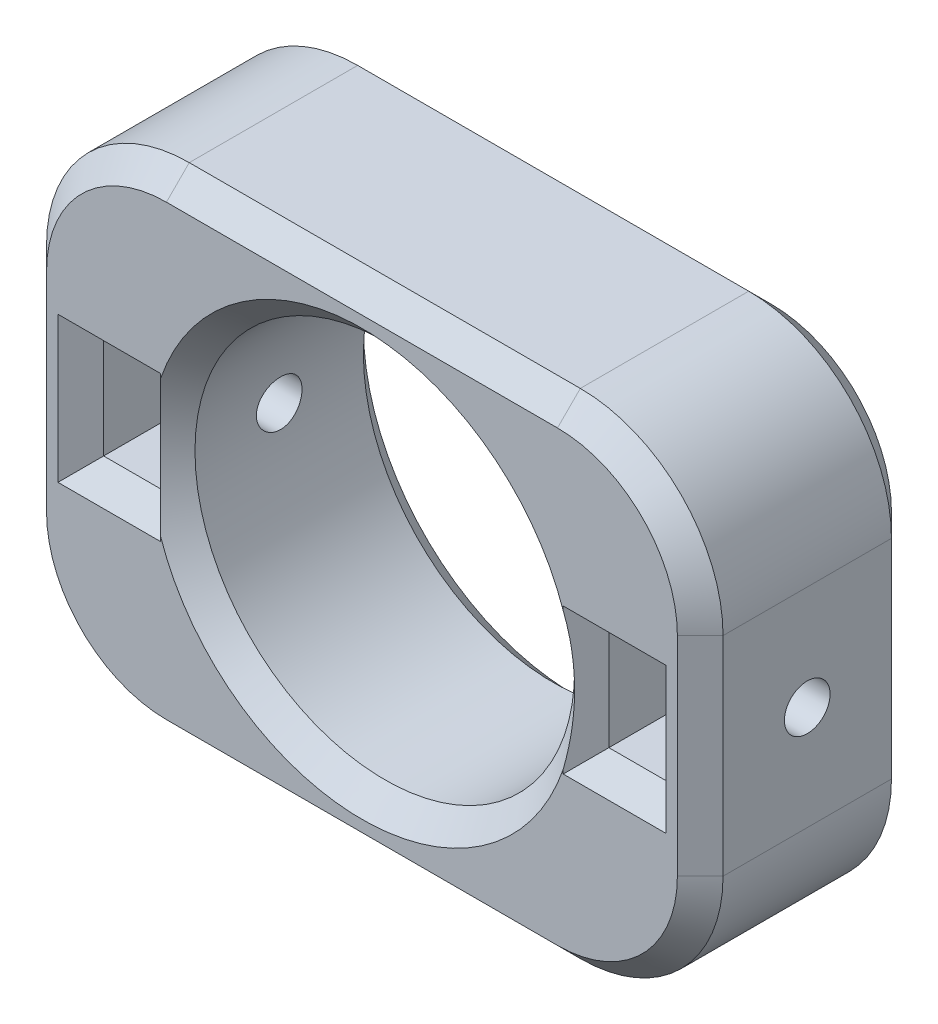
from build123d import *

# Parameters (mm, degrees)
SKETCH1_W           = 47.4
SKETCH1_H           = 34.6
SKETCH1_R           = 13.3
BOSS_EXTRUDE1_DEPTH = 15
SKETCH2_R           = 1.6
CUT_EXTRUDE1_DEPTH  = 53.640763672
SKETCH3_W           = 4
SKETCH3_H           = 7
CUT_EXTRUDE2_DEPTH  = 13
CHAMFER1_SIZE       = 1.6
FILLET1_R           = 10
CHAMFER3_SIZE       = 1.6
CHAMFER4_SIZE       = 1.6


with BuildPart() as part:
    # Sketch1 → Boss-Extrude1 (new body)
    with BuildSketch(Plane.XY):
        Rectangle(SKETCH1_W, SKETCH1_H)
        Circle(SKETCH1_R, mode=Mode.SUBTRACT)
    extrude(amount=BOSS_EXTRUDE1_DEPTH)

    # Sketch2 → Cut-Extrude1 (cut, through all)
    with BuildSketch(Plane(origin=(23.7, 0, 0), x_dir=(0, 0, -1), z_dir=(1, 0, 0))):
        with Locations((-7.5, 0)):
            Circle(SKETCH2_R)
    extrude(amount=-CUT_EXTRUDE1_DEPTH, mode=Mode.SUBTRACT)

    # Sketch3 → Cut-Extrude2 (cut)
    with BuildSketch(Plane.XY.offset(15)):
        with Locations((17.7, 0)):
            Rectangle(SKETCH3_W, SKETCH3_H)
        with Locations((-17.7, 0)):
            Rectangle(SKETCH3_W, SKETCH3_H)
    extrude(amount=-CUT_EXTRUDE2_DEPTH, mode=Mode.SUBTRACT)

    # Chamfer1
    chamfer1_edges = [part.edges().sort_by_distance(p)[0] for p in [
        (-13.3, 0, 15),
    ]]
    chamfer(chamfer1_edges, length=CHAMFER1_SIZE)

    # Chamfer2
    # the kernel refuses this chamfer: 1.6 mm, written as the material it takes off along each edge
    with BuildSketch(Plane(origin=(19.7, -3.5, 15), x_dir=(0.9996219169112968, 0, 0.027495876610586226), z_dir=(0, 1, 0)), Plane(origin=(15.7, 3.5, 15), x_dir=(-0.9996219169112968, 0, 0.027495876610586285), z_dir=(0, -1, 0)), Plane(origin=(-15.7, -3.5, 15), x_dir=(0.9996219169112968, 0, 0.027495876610586285), z_dir=(0, 1, 0)), Plane(origin=(-19.7, 3.5, 15), x_dir=(-0.9996219169112968, 0, 0.027495876610586226), z_dir=(0, -1, 0))) as chamfer2_piece_1:
        with BuildLine():
            Line((1.645877112, 0), (-0.090475448, 1.64338847))
            Line((-0.090475448, 1.64338847), (-0.122463349, 1.642508602))
            ThreePointArc((-0.122463349, 1.642508602), (-0.054606763, 0.821436527), (-0.031987901, -0.000879868))
            Line((-0.031987901, -0.000879868), (0.000879868, -0.031987901))
            ThreePointArc((0.000879868, -0.031987901), (0.823196264, -0.009369039), (1.64675698, -0.031987901))
            Line((1.64675698, -0.031987901), (1.645877112, 0))
        make_face()
    extrude(amount=7, mode=Mode.SUBTRACT)
    with BuildSketch(Plane(origin=(19.7, 3.5, 15), x_dir=(0, 0.9996219169112968, 0.027495876610586285), z_dir=(-1, 0, 0)), Plane(origin=(15.7, -3.5, 15), x_dir=(0, -0.9996219169112968, 0.02749587661058628), z_dir=(1, 0, 0)), Plane(origin=(-15.7, 3.5, 15), x_dir=(2.330586862957201e-15, 0.9996219169112966, 0.027495876610586265), z_dir=(-1, 0, 0)), Plane(origin=(-19.7, -3.5, 15), x_dir=(2.3305868629572013e-15, -0.9996219169112968, 0.02749587661058628), z_dir=(1, 0, 0))) as chamfer2_piece_2:
        with BuildLine():
            Line((1.645877112, 0), (-0.090475448, 1.64338847))
            Line((-0.090475448, 1.64338847), (-0.122463349, 1.642508602))
            ThreePointArc((-0.122463349, 1.642508602), (-0.054606763, 0.821436527), (-0.031987901, -0.000879868))
            Line((-0.031987901, -0.000879868), (0.000879868, -0.031987901))
            ThreePointArc((0.000879868, -0.031987901), (0.823196264, -0.009369039), (1.64675698, -0.031987901))
            Line((1.64675698, -0.031987901), (1.645877112, 0))
        make_face()
    extrude(amount=4, mode=Mode.SUBTRACT)
    with BuildSketch(Plane(origin=(15.7, -3.5, 15), x_dir=(0, -0.9996219169112968, 0.02749587661058628), z_dir=(1, 0, 0))) as chamfer2_piece_3a_section:
        with BuildLine():
            Line((1.645877112, 0), (-0.090475448, 1.64338847))
            Line((-0.090475448, 1.64338847), (-0.122463349, 1.642508602))
            ThreePointArc((-0.122463349, 1.642508602), (-0.054606763, 0.821436527), (-0.031987901, -0.000879868))
            Line((-0.031987901, -0.000879868), (0.000879868, -0.031987901))
            ThreePointArc((0.000879868, -0.031987901), (0.823196264, -0.009369039), (1.64675698, -0.031987901))
            Line((1.64675698, -0.031987901), (1.645877112, 0))
        make_face()
    chamfer2_piece_3a = extrude(amount=8.114692781, mode=Mode.PRIVATE)
    chamfer2_piece_3a = split(chamfer2_piece_3a, bisect_by=Plane(origin=(19.7, -4.027669803, 14.472330197), z_dir=(1, 0, 0)), keep=Keep.TOP, mode=Mode.PRIVATE)
    with BuildSketch(Plane(origin=(19.7, -7.614692781, 15), x_dir=(0.9996219169112968, 0, 0.027495876610586226), z_dir=(0, 1, 0))) as chamfer2_piece_3b_section:
        with BuildLine():
            Line((1.645877112, 0), (-0.090475448, 1.64338847))
            Line((-0.090475448, 1.64338847), (-0.122463349, 1.642508602))
            ThreePointArc((-0.122463349, 1.642508602), (-0.054606763, 0.821436527), (-0.031987901, -0.000879868))
            Line((-0.031987901, -0.000879868), (0.000879868, -0.031987901))
            ThreePointArc((0.000879868, -0.031987901), (0.823196264, -0.009369039), (1.64675698, -0.031987901))
            Line((1.64675698, -0.031987901), (1.645877112, 0))
        make_face()
    chamfer2_piece_3b = extrude(amount=11.114692781, mode=Mode.PRIVATE)
    chamfer2_piece_3b = split(chamfer2_piece_3b, bisect_by=Plane(origin=(20.227669803, -3.5, 14.472330197), z_dir=(0, -1, 0)), keep=Keep.TOP, mode=Mode.PRIVATE)
    chamfer2_piece_3 = chamfer2_piece_3a & chamfer2_piece_3b
    add(chamfer2_piece_3, mode=Mode.SUBTRACT)
    with BuildSketch(Plane(origin=(19.7, -3.5, 15), x_dir=(0.9996219169112968, 0, 0.027495876610586226), z_dir=(0, 1, 0))) as chamfer2_piece_4a_section:
        with BuildLine():
            Line((1.645877112, 0), (-0.090475448, 1.64338847))
            Line((-0.090475448, 1.64338847), (-0.122463349, 1.642508602))
            ThreePointArc((-0.122463349, 1.642508602), (-0.054606763, 0.821436527), (-0.031987901, -0.000879868))
            Line((-0.031987901, -0.000879868), (0.000879868, -0.031987901))
            ThreePointArc((0.000879868, -0.031987901), (0.823196264, -0.009369039), (1.64675698, -0.031987901))
            Line((1.64675698, -0.031987901), (1.645877112, 0))
        make_face()
    chamfer2_piece_4a = extrude(amount=11.114692781, mode=Mode.PRIVATE)
    chamfer2_piece_4a = split(chamfer2_piece_4a, bisect_by=Plane(origin=(20.227669803, 3.5, 14.472330197), z_dir=(0, 1, 0)), keep=Keep.TOP, mode=Mode.PRIVATE)
    with BuildSketch(Plane(origin=(23.814692781, 3.5, 15), x_dir=(0, 0.9996219169112968, 0.02749587661058628), z_dir=(-1, 0, 0))) as chamfer2_piece_4b_section:
        with BuildLine():
            Line((1.645877112, 0), (-0.090475448, 1.64338847))
            Line((-0.090475448, 1.64338847), (-0.122463349, 1.642508602))
            ThreePointArc((-0.122463349, 1.642508602), (-0.054606763, 0.821436527), (-0.031987901, -0.000879868))
            Line((-0.031987901, -0.000879868), (0.000879868, -0.031987901))
            ThreePointArc((0.000879868, -0.031987901), (0.823196264, -0.009369039), (1.64675698, -0.031987901))
            Line((1.64675698, -0.031987901), (1.645877112, 0))
        make_face()
    chamfer2_piece_4b = extrude(amount=8.114692781, mode=Mode.PRIVATE)
    chamfer2_piece_4b = split(chamfer2_piece_4b, bisect_by=Plane(origin=(19.7, 4.027669803, 14.472330197), z_dir=(1, 0, 0)), keep=Keep.TOP, mode=Mode.PRIVATE)
    chamfer2_piece_4 = chamfer2_piece_4a & chamfer2_piece_4b
    add(chamfer2_piece_4, mode=Mode.SUBTRACT)
    with BuildSketch(Plane(origin=(19.7, 3.5, 15), x_dir=(0, 0.9996219169112968, 0.027495876610586285), z_dir=(-1, 0, 0))) as chamfer2_piece_5a_section:
        with BuildLine():
            Line((1.645877112, 0), (-0.090475448, 1.64338847))
            Line((-0.090475448, 1.64338847), (-0.122463349, 1.642508602))
            ThreePointArc((-0.122463349, 1.642508602), (-0.054606763, 0.821436527), (-0.031987901, -0.000879868))
            Line((-0.031987901, -0.000879868), (0.000879868, -0.031987901))
            ThreePointArc((0.000879868, -0.031987901), (0.823196264, -0.009369039), (1.64675698, -0.031987901))
            Line((1.64675698, -0.031987901), (1.645877112, 0))
        make_face()
    chamfer2_piece_5a = extrude(amount=8.114692781, mode=Mode.PRIVATE)
    chamfer2_piece_5a = split(chamfer2_piece_5a, bisect_by=Plane(origin=(15.7, 4.027669803, 14.472330197), z_dir=(-1, 0, 0)), keep=Keep.TOP, mode=Mode.PRIVATE)
    with BuildSketch(Plane(origin=(15.7, 7.614692781, 15), x_dir=(-0.9996219169112968, 0, 0.027495876610586285), z_dir=(0, -1, 0))) as chamfer2_piece_5b_section:
        with BuildLine():
            Line((1.645877112, 0), (-0.090475448, 1.64338847))
            Line((-0.090475448, 1.64338847), (-0.122463349, 1.642508602))
            ThreePointArc((-0.122463349, 1.642508602), (-0.054606763, 0.821436527), (-0.031987901, -0.000879868))
            Line((-0.031987901, -0.000879868), (0.000879868, -0.031987901))
            ThreePointArc((0.000879868, -0.031987901), (0.823196264, -0.009369039), (1.64675698, -0.031987901))
            Line((1.64675698, -0.031987901), (1.645877112, 0))
        make_face()
    chamfer2_piece_5b = extrude(amount=11.114692781, mode=Mode.PRIVATE)
    chamfer2_piece_5b = split(chamfer2_piece_5b, bisect_by=Plane(origin=(15.172330197, 3.5, 14.472330197), z_dir=(0, 1, 0)), keep=Keep.TOP, mode=Mode.PRIVATE)
    chamfer2_piece_5 = chamfer2_piece_5a & chamfer2_piece_5b
    add(chamfer2_piece_5, mode=Mode.SUBTRACT)
    with BuildSketch(Plane(origin=(11.585307219, -3.5, 15), x_dir=(0, -0.9996219169112966, 0.027495876610586265), z_dir=(1, 0, 0))) as chamfer2_piece_6a_section:
        with BuildLine():
            Line((1.645877112, 0), (-0.090475448, 1.64338847))
            Line((-0.090475448, 1.64338847), (-0.122463349, 1.642508602))
            ThreePointArc((-0.122463349, 1.642508602), (-0.054606763, 0.821436527), (-0.031987901, -0.000879868))
            Line((-0.031987901, -0.000879868), (0.000879868, -0.031987901))
            ThreePointArc((0.000879868, -0.031987901), (0.823196264, -0.009369039), (1.64675698, -0.031987901))
            Line((1.64675698, -0.031987901), (1.645877112, 0))
        make_face()
    chamfer2_piece_6a = extrude(amount=8.114692781, mode=Mode.PRIVATE)
    chamfer2_piece_6a = split(chamfer2_piece_6a, bisect_by=Plane(origin=(15.7, -4.027669803, 14.472330197), z_dir=(-1, 0, 0)), keep=Keep.TOP, mode=Mode.PRIVATE)
    with BuildSketch(Plane(origin=(15.7, 3.5, 15), x_dir=(-0.9996219169112968, 0, 0.027495876610586285), z_dir=(0, -1, 0))) as chamfer2_piece_6b_section:
        with BuildLine():
            Line((1.645877112, 0), (-0.090475448, 1.64338847))
            Line((-0.090475448, 1.64338847), (-0.122463349, 1.642508602))
            ThreePointArc((-0.122463349, 1.642508602), (-0.054606763, 0.821436527), (-0.031987901, -0.000879868))
            Line((-0.031987901, -0.000879868), (0.000879868, -0.031987901))
            ThreePointArc((0.000879868, -0.031987901), (0.823196264, -0.009369039), (1.64675698, -0.031987901))
            Line((1.64675698, -0.031987901), (1.645877112, 0))
        make_face()
    chamfer2_piece_6b = extrude(amount=11.114692781, mode=Mode.PRIVATE)
    chamfer2_piece_6b = split(chamfer2_piece_6b, bisect_by=Plane(origin=(15.172330197, -3.5, 14.472330197), z_dir=(0, -1, 0)), keep=Keep.TOP, mode=Mode.PRIVATE)
    chamfer2_piece_6 = chamfer2_piece_6a & chamfer2_piece_6b
    add(chamfer2_piece_6, mode=Mode.SUBTRACT)
    with BuildSketch(Plane(origin=(-19.7, -3.5, 15), x_dir=(2.3305868629572013e-15, -0.9996219169112968, 0.02749587661058628), z_dir=(1, 0, 0))) as chamfer2_piece_7a_section:
        with BuildLine():
            Line((1.645877112, 0), (-0.090475448, 1.64338847))
            Line((-0.090475448, 1.64338847), (-0.122463349, 1.642508602))
            ThreePointArc((-0.122463349, 1.642508602), (-0.054606763, 0.821436527), (-0.031987901, -0.000879868))
            Line((-0.031987901, -0.000879868), (0.000879868, -0.031987901))
            ThreePointArc((0.000879868, -0.031987901), (0.823196264, -0.009369039), (1.64675698, -0.031987901))
            Line((1.64675698, -0.031987901), (1.645877112, 0))
        make_face()
    chamfer2_piece_7a = extrude(amount=8.114692781, mode=Mode.PRIVATE)
    chamfer2_piece_7a = split(chamfer2_piece_7a, bisect_by=Plane(origin=(-15.7, -4.027669803, 14.472330197), z_dir=(1, 0, 0)), keep=Keep.TOP, mode=Mode.PRIVATE)
    with BuildSketch(Plane(origin=(-15.7, -7.614692781, 15), x_dir=(0.9996219169112968, 0, 0.027495876610586285), z_dir=(0, 1, 0))) as chamfer2_piece_7b_section:
        with BuildLine():
            Line((1.645877112, 0), (-0.090475448, 1.64338847))
            Line((-0.090475448, 1.64338847), (-0.122463349, 1.642508602))
            ThreePointArc((-0.122463349, 1.642508602), (-0.054606763, 0.821436527), (-0.031987901, -0.000879868))
            Line((-0.031987901, -0.000879868), (0.000879868, -0.031987901))
            ThreePointArc((0.000879868, -0.031987901), (0.823196264, -0.009369039), (1.64675698, -0.031987901))
            Line((1.64675698, -0.031987901), (1.645877112, 0))
        make_face()
    chamfer2_piece_7b = extrude(amount=11.114692781, mode=Mode.PRIVATE)
    chamfer2_piece_7b = split(chamfer2_piece_7b, bisect_by=Plane(origin=(-15.172330197, -3.5, 14.472330197), z_dir=(0, -1, 0)), keep=Keep.TOP, mode=Mode.PRIVATE)
    chamfer2_piece_7 = chamfer2_piece_7a & chamfer2_piece_7b
    add(chamfer2_piece_7, mode=Mode.SUBTRACT)
    with BuildSketch(Plane(origin=(-11.585307219, 3.5, 15), x_dir=(2.3305868629572017e-15, 0.9996219169112968, 0.027495876610586285), z_dir=(-1, 0, 0))) as chamfer2_piece_8a_section:
        with BuildLine():
            Line((1.645877112, 0), (-0.090475448, 1.64338847))
            Line((-0.090475448, 1.64338847), (-0.122463349, 1.642508602))
            ThreePointArc((-0.122463349, 1.642508602), (-0.054606763, 0.821436527), (-0.031987901, -0.000879868))
            Line((-0.031987901, -0.000879868), (0.000879868, -0.031987901))
            ThreePointArc((0.000879868, -0.031987901), (0.823196264, -0.009369039), (1.64675698, -0.031987901))
            Line((1.64675698, -0.031987901), (1.645877112, 0))
        make_face()
    chamfer2_piece_8a = extrude(amount=8.114692781, mode=Mode.PRIVATE)
    chamfer2_piece_8a = split(chamfer2_piece_8a, bisect_by=Plane(origin=(-15.7, 4.027669803, 14.472330197), z_dir=(1, 0, 0)), keep=Keep.TOP, mode=Mode.PRIVATE)
    with BuildSketch(Plane(origin=(-15.7, -3.5, 15), x_dir=(0.9996219169112968, 0, 0.027495876610586285), z_dir=(0, 1, 0))) as chamfer2_piece_8b_section:
        with BuildLine():
            Line((1.645877112, 0), (-0.090475448, 1.64338847))
            Line((-0.090475448, 1.64338847), (-0.122463349, 1.642508602))
            ThreePointArc((-0.122463349, 1.642508602), (-0.054606763, 0.821436527), (-0.031987901, -0.000879868))
            Line((-0.031987901, -0.000879868), (0.000879868, -0.031987901))
            ThreePointArc((0.000879868, -0.031987901), (0.823196264, -0.009369039), (1.64675698, -0.031987901))
            Line((1.64675698, -0.031987901), (1.645877112, 0))
        make_face()
    chamfer2_piece_8b = extrude(amount=11.114692781, mode=Mode.PRIVATE)
    chamfer2_piece_8b = split(chamfer2_piece_8b, bisect_by=Plane(origin=(-15.172330197, 3.5, 14.472330197), z_dir=(0, 1, 0)), keep=Keep.TOP, mode=Mode.PRIVATE)
    chamfer2_piece_8 = chamfer2_piece_8a & chamfer2_piece_8b
    add(chamfer2_piece_8, mode=Mode.SUBTRACT)
    with BuildSketch(Plane(origin=(-15.7, 3.5, 15), x_dir=(2.330586862957201e-15, 0.9996219169112966, 0.027495876610586265), z_dir=(-1, 0, 0))) as chamfer2_piece_9a_section:
        with BuildLine():
            Line((1.645877112, 0), (-0.090475448, 1.64338847))
            Line((-0.090475448, 1.64338847), (-0.122463349, 1.642508602))
            ThreePointArc((-0.122463349, 1.642508602), (-0.054606763, 0.821436527), (-0.031987901, -0.000879868))
            Line((-0.031987901, -0.000879868), (0.000879868, -0.031987901))
            ThreePointArc((0.000879868, -0.031987901), (0.823196264, -0.009369039), (1.64675698, -0.031987901))
            Line((1.64675698, -0.031987901), (1.645877112, 0))
        make_face()
    chamfer2_piece_9a = extrude(amount=8.114692781, mode=Mode.PRIVATE)
    chamfer2_piece_9a = split(chamfer2_piece_9a, bisect_by=Plane(origin=(-19.7, 4.027669803, 14.472330197), z_dir=(-1, 0, 0)), keep=Keep.TOP, mode=Mode.PRIVATE)
    with BuildSketch(Plane(origin=(-19.7, 7.614692781, 15), x_dir=(-0.9996219169112968, 0, 0.027495876610586226), z_dir=(0, -1, 0))) as chamfer2_piece_9b_section:
        with BuildLine():
            Line((1.645877112, 0), (-0.090475448, 1.64338847))
            Line((-0.090475448, 1.64338847), (-0.122463349, 1.642508602))
            ThreePointArc((-0.122463349, 1.642508602), (-0.054606763, 0.821436527), (-0.031987901, -0.000879868))
            Line((-0.031987901, -0.000879868), (0.000879868, -0.031987901))
            ThreePointArc((0.000879868, -0.031987901), (0.823196264, -0.009369039), (1.64675698, -0.031987901))
            Line((1.64675698, -0.031987901), (1.645877112, 0))
        make_face()
    chamfer2_piece_9b = extrude(amount=11.114692781, mode=Mode.PRIVATE)
    chamfer2_piece_9b = split(chamfer2_piece_9b, bisect_by=Plane(origin=(-20.227669803, 3.5, 14.472330197), z_dir=(0, 1, 0)), keep=Keep.TOP, mode=Mode.PRIVATE)
    chamfer2_piece_9 = chamfer2_piece_9a & chamfer2_piece_9b
    add(chamfer2_piece_9, mode=Mode.SUBTRACT)
    with BuildSketch(Plane(origin=(-19.7, 3.5, 15), x_dir=(-0.9996219169112968, 0, 0.027495876610586226), z_dir=(0, -1, 0))) as chamfer2_piece_10a_section:
        with BuildLine():
            Line((1.645877112, 0), (-0.090475448, 1.64338847))
            Line((-0.090475448, 1.64338847), (-0.122463349, 1.642508602))
            ThreePointArc((-0.122463349, 1.642508602), (-0.054606763, 0.821436527), (-0.031987901, -0.000879868))
            Line((-0.031987901, -0.000879868), (0.000879868, -0.031987901))
            ThreePointArc((0.000879868, -0.031987901), (0.823196264, -0.009369039), (1.64675698, -0.031987901))
            Line((1.64675698, -0.031987901), (1.645877112, 0))
        make_face()
    chamfer2_piece_10a = extrude(amount=11.114692781, mode=Mode.PRIVATE)
    chamfer2_piece_10a = split(chamfer2_piece_10a, bisect_by=Plane(origin=(-20.227669803, -3.5, 14.472330197), z_dir=(0, -1, 0)), keep=Keep.TOP, mode=Mode.PRIVATE)
    with BuildSketch(Plane(origin=(-23.814692781, -3.5, 15), x_dir=(2.3305868629572013e-15, -0.9996219169112968, 0.02749587661058628), z_dir=(1, 0, 0))) as chamfer2_piece_10b_section:
        with BuildLine():
            Line((1.645877112, 0), (-0.090475448, 1.64338847))
            Line((-0.090475448, 1.64338847), (-0.122463349, 1.642508602))
            ThreePointArc((-0.122463349, 1.642508602), (-0.054606763, 0.821436527), (-0.031987901, -0.000879868))
            Line((-0.031987901, -0.000879868), (0.000879868, -0.031987901))
            ThreePointArc((0.000879868, -0.031987901), (0.823196264, -0.009369039), (1.64675698, -0.031987901))
            Line((1.64675698, -0.031987901), (1.645877112, 0))
        make_face()
    chamfer2_piece_10b = extrude(amount=8.114692781, mode=Mode.PRIVATE)
    chamfer2_piece_10b = split(chamfer2_piece_10b, bisect_by=Plane(origin=(-19.7, -4.027669803, 14.472330197), z_dir=(-1, 0, 0)), keep=Keep.TOP, mode=Mode.PRIVATE)
    chamfer2_piece_10 = chamfer2_piece_10a & chamfer2_piece_10b
    add(chamfer2_piece_10, mode=Mode.SUBTRACT)

    # Fillet1
    fillet1_edges = [part.edges().sort_by_distance(p)[0] for p in [
        (23.7, -17.3, 7.5),
        (-23.7, -17.3, 7.5),
        (-23.7, 17.3, 7.5),
        (23.7, 17.3, 7.5),
    ]]
    fillet(fillet1_edges, radius=FILLET1_R)

    # Chamfer3
    chamfer3_edges = [part.edges().sort_by_distance(p)[0] for p in [
        (-13.3, 0, 0),
        (0, 17.3, 0),
        (23.7, 0, 0),
        (0, -17.3, 0),
        (-23.7, 0, 0),
        (-20.771067812, 14.371067812, 0),
        (-20.771067812, -14.371067812, 0),
        (20.771067812, -14.371067812, 0),
        (20.771067812, 14.371067812, 0),
    ]]
    chamfer(chamfer3_edges, length=CHAMFER3_SIZE)

    # Chamfer4
    chamfer4_edges = [part.edges().sort_by_distance(p)[0] for p in [
        (-23.7, 0, 15),
        (0, -17.3, 15),
        (-20.771067812, 14.371067812, 15),
        (-20.771067812, -14.371067812, 15),
        (20.771067812, -14.371067812, 15),
        (20.771067812, 14.371067812, 15),
        (0, 17.3, 15),
        (23.7, 0, 15),
    ]]
    chamfer(chamfer4_edges, length=CHAMFER4_SIZE)


solid = part.part
